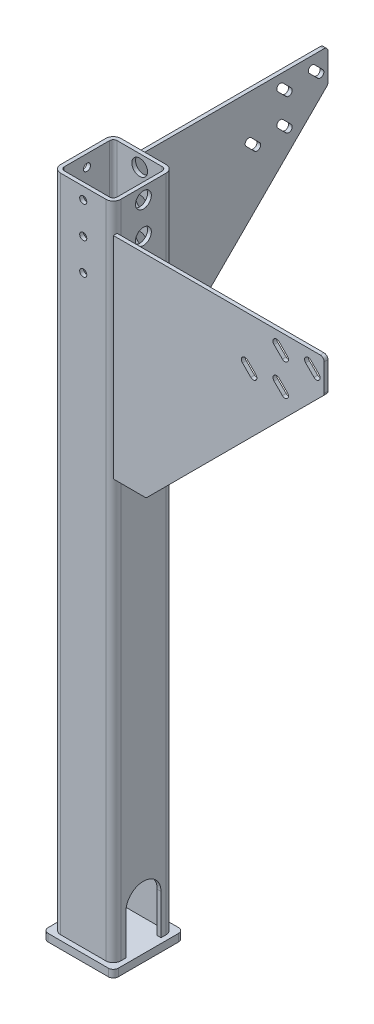
from build123d import *

# Parameters (mm, degrees)
TUBE_SQUARE_TS3X3X0_1875_1_DEPTH    = 835
CUT_EXTRUDE3_REACH                  = 727.023
BASE_FLANGE1_DEPTH                  = 4.7625
SKETCH18_W                          = 4.5
SKETCH18_H                          = 4.7635
M8_CLEARANCE_HOLE1_AT_2_COUNT       = 2
M8_CLEARANCE_HOLE1_AT_2_PITCH       = 40
M8_CLEARANCE_HOLE1_AT_3_COUNT       = 2
M8_CLEARANCE_HOLE1_AT_3_PITCH       = 80
SKETCH21_W                          = 10
SKETCH21_H                          = 4.7635
F_20_0_20_DIAMETER_HOLE1_AT_2_COUNT = 2
F_20_0_20_DIAMETER_HOLE1_AT_2_PITCH = 40
F_20_0_20_DIAMETER_HOLE1_AT_3_COUNT = 2
F_20_0_20_DIAMETER_HOLE1_AT_3_PITCH = 80
CUT_EXTRUDE2_DEPTH                  = 4.7625
FILLET1_R                           = 5
BASE_FLANGE2_DEPTH                  = 9.525
SKETCH26_W                          = 5.15874
SKETCH26_H                          = 9.526
MIRROR1_COPY_1_SKETCH_W             = 4.5
MIRROR1_COPY_1_SKETCH_H             = 4.7635
MIRROR1_COPY_2_SKETCH_W             = 4.5
MIRROR1_COPY_2_SKETCH_H             = 4.7635
MIRROR1_COPY_3_SKETCH_W             = 10
MIRROR1_COPY_3_SKETCH_H             = 4.7635
MIRROR1_COPY_4_SKETCH_W             = 10
MIRROR1_COPY_4_SKETCH_H             = 4.7635


# Sheet-metal steps are written as plain solids
with BuildPart() as part:
    # Sketch11 → Tube square TS3X3X0.1875(1) (new body)
    with BuildSketch(Plane.XZ.offset(-115)):
        with BuildLine():
            Line((-28.575, -38.1), (28.575, -38.1))
            ThreePointArc((28.575, -38.1), (35.310192091, -35.310192091), (38.1, -28.575))
            Line((38.1, -28.575), (38.1, 28.575))
            ThreePointArc((38.1, 28.575), (35.310192091, 35.310192091), (28.575, 38.1))
            Line((28.575, 38.1), (-28.575, 38.1))
            ThreePointArc((-28.575, 38.1), (-35.310192091, 35.310192091), (-38.1, 28.575))
            Line((-38.1, 28.575), (-38.1, -28.575))
            ThreePointArc((-38.1, -28.575), (-35.310192091, -35.310192091), (-28.575, -38.1))
        make_face()
        with BuildLine():
            Line((-28.575, -33.3375), (28.575, -33.3375))
            ThreePointArc((28.575, -33.3375), (31.942596045, -31.942596045), (33.3375, -28.575))
            Line((33.3375, -28.575), (33.3375, 28.575))
            ThreePointArc((33.3375, 28.575), (31.942596045, 31.942596045), (28.575, 33.3375))
            Line((28.575, 33.3375), (-28.575, 33.3375))
            ThreePointArc((-28.575, 33.3375), (-31.942596045, 31.942596045), (-33.3375, 28.575))
            Line((-33.3375, 28.575), (-33.3375, -28.575))
            ThreePointArc((-33.3375, -28.575), (-31.942596045, -31.942596045), (-28.575, -33.3375))
        make_face(mode=Mode.SUBTRACT)
    extrude(amount=TUBE_SQUARE_TS3X3X0_1875_1_DEPTH)

    # Sketch27 → Cut-Extrude3 (cut, up to next)
    with BuildSketch(Plane(origin=(38.1, 0, 0), x_dir=(0, 0, -1), z_dir=(1, 0, 0)), mode=Mode.PRIVATE) as cut_extrude3_sk1:
        with BuildLine():
            Line((-22.225, -720), (22.225, -720))
            Line((22.225, -720), (22.225, -669.2))
            ThreePointArc((22.225, -669.2), (0, -646.975), (-22.225, -669.2))
            Line((-22.225, -669.2), (-22.225, -720))
        make_face()
    cut_extrude3_tool1 = extrude(cut_extrude3_sk1.sketch, amount=-CUT_EXTRUDE3_REACH, mode=Mode.PRIVATE) & part.part
    add(cut_extrude3_tool1.solids().sort_by_distance((38.1, -685.692007, 0))[0], mode=Mode.SUBTRACT)

    # Sketch18 → M8 Clearance Hole1 (revolve, cut)
    with BuildSketch(Plane(origin=(0, 100, 38.1), x_dir=(0, -1, 0), z_dir=(1, 0, 0))):
        with Locations((2.25, 2.38175)):
            Rectangle(SKETCH18_W, SKETCH18_H)
    m8_clearance_hole1 = revolve(axis=Axis((0, 100, 44.45), (0, 0, -1)), mode=Mode.SUBTRACT)

    # M8 Clearance Hole1 at 2: M8 Clearance Hole1 ×2
    with Locations(*[(0, -i * M8_CLEARANCE_HOLE1_AT_2_PITCH, 0) for i in range(1, M8_CLEARANCE_HOLE1_AT_2_COUNT)]):
        add(m8_clearance_hole1, mode=Mode.SUBTRACT)

    # M8 Clearance Hole1 at 3: M8 Clearance Hole1 ×2
    with Locations(*[(0, -i * M8_CLEARANCE_HOLE1_AT_3_PITCH, 0) for i in range(1, M8_CLEARANCE_HOLE1_AT_3_COUNT)]):
        add(m8_clearance_hole1, mode=Mode.SUBTRACT)

    # Sketch21 → Ø20.0 (20) Diameter Hole1 (revolve, cut)
    with BuildSketch(Plane(origin=(0, 100, -38.1), x_dir=(0, 1, 0), z_dir=(1, 0, 0))):
        with Locations((5, 2.38175)):
            Rectangle(SKETCH21_W, SKETCH21_H)
    f_20_0_20_diameter_hole1 = revolve(axis=Axis((0, 100, -44.45), (0, 0, 1)), mode=Mode.SUBTRACT)

    # Ø20.0 (20) Diameter Hole1 at 2: Ø20.0 (20) Diameter Hole1 ×2
    with Locations(*[(0, -i * F_20_0_20_DIAMETER_HOLE1_AT_2_PITCH, 0) for i in range(1, F_20_0_20_DIAMETER_HOLE1_AT_2_COUNT)]):
        add(f_20_0_20_diameter_hole1, mode=Mode.SUBTRACT)

    # Ø20.0 (20) Diameter Hole1 at 3: Ø20.0 (20) Diameter Hole1 ×2
    with Locations(*[(0, -i * F_20_0_20_DIAMETER_HOLE1_AT_3_PITCH, 0) for i in range(1, F_20_0_20_DIAMETER_HOLE1_AT_3_COUNT)]):
        add(f_20_0_20_diameter_hole1, mode=Mode.SUBTRACT)

    # Mirror1: M8 Clearance Hole1, Ø20.0 (20) Diameter Hole1 across plane
    add(m8_clearance_hole1.mirror(Plane(origin=(0, 0, 0), x_dir=(-0.7071067811865465, 0, 0.7071067811865486), z_dir=(0.7071067811865488, 0, 0.7071067811865464))), mode=Mode.SUBTRACT)
    add(f_20_0_20_diameter_hole1.mirror(Plane(origin=(0, 0, 0), x_dir=(-0.7071067811865465, 0, 0.7071067811865486), z_dir=(0.7071067811865488, 0, 0.7071067811865464))), mode=Mode.SUBTRACT)

    # Mirror1 copy 1 sketch → Mirror1 copy 1 (revolve, cut)
    with BuildSketch(Plane(origin=(-38.1, 60, 0), x_dir=(0, -1, 0), z_dir=(0, 0, -1))):
        with Locations((2.25, -2.38175)):
            Rectangle(MIRROR1_COPY_1_SKETCH_W, MIRROR1_COPY_1_SKETCH_H)
    revolve(axis=Axis((-44.45, 60, 0), (-1, 0, 0)), mode=Mode.SUBTRACT)

    # Mirror1 copy 2 sketch → Mirror1 copy 2 (revolve, cut)
    with BuildSketch(Plane(origin=(-38.1, 20, 0), x_dir=(0, -1, 0), z_dir=(0, 0, -1))):
        with Locations((2.25, -2.38175)):
            Rectangle(MIRROR1_COPY_2_SKETCH_W, MIRROR1_COPY_2_SKETCH_H)
    revolve(axis=Axis((-44.45, 20, 0), (-1, 0, 0)), mode=Mode.SUBTRACT)

    # Mirror1 copy 3 sketch → Mirror1 copy 3 (revolve, cut)
    with BuildSketch(Plane(origin=(38.1, 60, 0), x_dir=(0, 1, 0), z_dir=(0, 0, -1))):
        with Locations((5, -2.38175)):
            Rectangle(MIRROR1_COPY_3_SKETCH_W, MIRROR1_COPY_3_SKETCH_H)
    revolve(axis=Axis((44.45, 60, 0), (1, 0, 0)), mode=Mode.SUBTRACT)

    # Mirror1 copy 4 sketch → Mirror1 copy 4 (revolve, cut)
    with BuildSketch(Plane(origin=(38.1, 20, 0), x_dir=(0, 1, 0), z_dir=(0, 0, -1))):
        with Locations((5, -2.38175)):
            Rectangle(MIRROR1_COPY_4_SKETCH_W, MIRROR1_COPY_4_SKETCH_H)
    revolve(axis=Axis((44.45, 20, 0), (1, 0, 0)), mode=Mode.SUBTRACT)


with BuildPart() as body_2:
    # Sketch12 → Base-Flange1 (new body)
    with BuildSketch(Plane.XY.offset(38.1)):
        Polygon((38.1, 80), (38.1, -186.9), (79.668542495, -186.9), (305, 38.431457505), (305, 80), align=None)
    extrude(amount=-BASE_FLANGE1_DEPTH)

    # Sketch19 → Cut-Extrude2 (cut)
    with BuildSketch(Plane.XY.offset(38.1)):
        with BuildLine():
            Line((207.878679656, 28.485281374), (218.485281374, 17.878679656))
            ThreePointArc((218.485281374, 17.878679656), (218.485281374, 11.514718626), (212.121320344, 11.514718626))
            Line((212.121320344, 11.514718626), (201.514718626, 22.121320344))
            ThreePointArc((201.514718626, 22.121320344), (201.514718626, 28.485281374), (207.878679656, 28.485281374))
        make_face()
    cut_extrude2 = extrude(amount=-CUT_EXTRUDE2_DEPTH, mode=Mode.SUBTRACT)

    # Sketch-Pattern1: Cut-Extrude2 at 3 more places
    with Locations((40, 0, 0), (40, 40, 0), (80, 40, 0)):
        add(cut_extrude2, mode=Mode.SUBTRACT)

    # Fillet1
    fillet1_edges = [body_2.edges().sort_by_distance(p)[0] for p in [
        (305, 80, 35.71875),
        (305, 38.431457505, 35.71875),
        (79.668542495, -186.9, 35.71875),
    ]]
    fillet(fillet1_edges, radius=FILLET1_R)


with BuildPart() as body_3:
    # Sketch22 → Base-Flange2 (new body)
    with BuildSketch(Plane.XZ.offset(720)):
        with BuildLine():
            Line((38.1, -44.45), (-38.1, -44.45))
            ThreePointArc((-38.1, -44.45), (-42.590128061, -42.590128061), (-44.45, -38.1))
            Line((-44.45, -38.1), (-44.45, 38.1))
            ThreePointArc((-44.45, 38.1), (-42.590128061, 42.590128061), (-38.1, 44.45))
            Line((-38.1, 44.45), (38.1, 44.45))
            ThreePointArc((38.1, 44.45), (42.590128061, 42.590128061), (44.45, 38.1))
            Line((44.45, 38.1), (44.45, -38.1))
            ThreePointArc((44.45, -38.1), (42.590128061, -42.590128061), (38.1, -44.45))
        make_face()
    extrude(amount=BASE_FLANGE2_DEPTH)

    # Sketch26 → 3/8 Clearance Hole1 (revolve, cut)
    with BuildSketch(Plane(origin=(0, -729.525, 0), x_dir=(0, 0, -1), z_dir=(1, 0, 0))):
        with Locations((2.57937, 4.763)):
            Rectangle(SKETCH26_W, SKETCH26_H)
    revolve(axis=Axis((0, -735.875, 0), (0, 1, 0)), mode=Mode.SUBTRACT)


with BuildPart() as body_4:
    # Mirror2: mirrored copy
    add(body_2.part.mirror(Plane(origin=(0, 0, 0), x_dir=(-0.7071067811865465, 0, 0.7071067811865486), z_dir=(0.7071067811865488, 0, 0.7071067811865464))))


solid = Compound([part.part, body_2.part, body_3.part, body_4.part])
